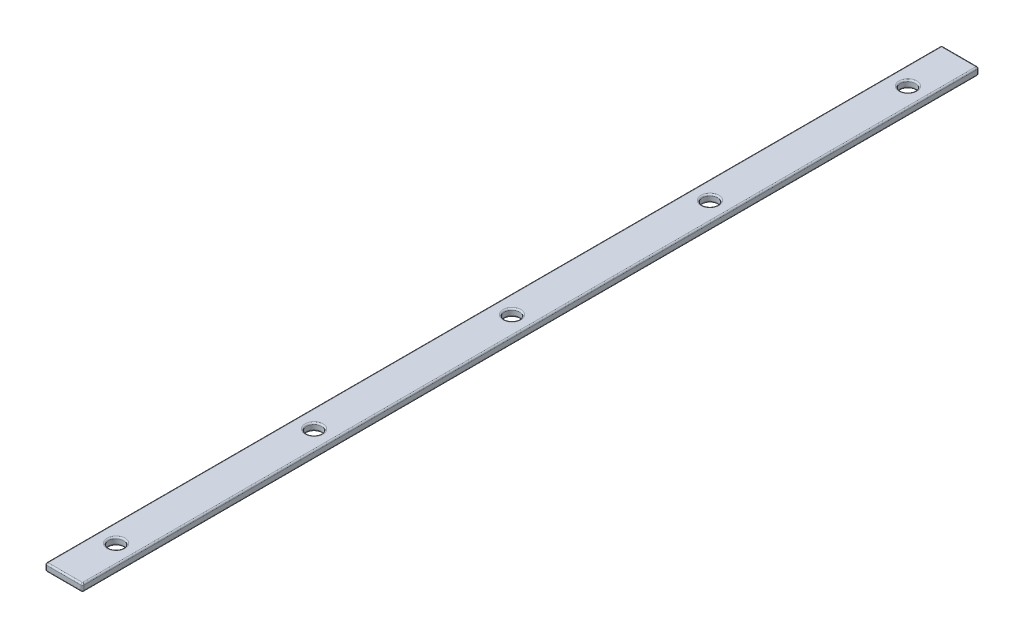
from build123d import *

# Parameters (mm, degrees)
CROQUIS1_W              = 50
CROQUIS1_H              = 1200
CROQUIS1_R              = 10
SALIENTE_EXTRUIR1_DEPTH = 10
REDONDEO1_R             = 2
REDONDEO2_R             = 2


with BuildPart() as part:
    # Croquis1 → Saliente-Extruir1 (new body)
    with BuildSketch(Plane(origin=(0, 0, 0), x_dir=(1, 0, 0), z_dir=(0, 1, 0))):
        Rectangle(CROQUIS1_W, CROQUIS1_H)
        with Locations(Location((0, 0, 0), (0, 0, 270))):
            Circle(CROQUIS1_R, mode=Mode.SUBTRACT)
        with Locations(Location((0, 265, 0), (0, 0, 270))):
            Circle(CROQUIS1_R, mode=Mode.SUBTRACT)
        with Locations(Location((0, 530, 0), (0, 0, 270))):
            Circle(CROQUIS1_R, mode=Mode.SUBTRACT)
        with Locations(Location((0, -530, 0), (0, 0, 270))):
            Circle(CROQUIS1_R, mode=Mode.SUBTRACT)
        with Locations(Location((0, -265, 0), (0, 0, 270))):
            Circle(CROQUIS1_R, mode=Mode.SUBTRACT)
    extrude(amount=SALIENTE_EXTRUIR1_DEPTH)

    # Redondeo1
    redondeo1_edges = [part.edges().sort_by_distance(p)[0] for p in [
        (0, 0, -275),
        (0, 10, -275),
        (-25, 10, 0),
        (0, 0, -10),
        (0, 10, -10),
        (0, 10, 600),
        (0, 0, -540),
        (0, 10, -540),
        (0, 0, 255),
        (0, 10, 255),
        (0, 0, 520),
        (0, 10, 520),
        (25, 10, 0),
        (0, 0, 600),
        (-25, 0, 0),
        (0, 0, -600),
        (25, 0, 0),
        (0, 10, -600),
    ]]
    fillet(redondeo1_edges, radius=REDONDEO1_R)

    # Redondeo2
    # the kernel refuses this fillet: 2 mm, written as the material it takes off along each edge
    with BuildSketch(Plane(origin=(-23, 8, -598), x_dir=(0, 0, -1), z_dir=(-1, 0, 0))) as redondeo2_piece_1_section:
        Polygon((0, 0), (REDONDEO2_R, 0), (REDONDEO2_R, -REDONDEO2_R), (0, -REDONDEO2_R), align=None)
    redondeo2_piece_1 = extrude(amount=REDONDEO2_R, mode=Mode.PRIVATE)
    redondeo2_piece_1 = redondeo2_piece_1 - Plane(origin=(-23, 8, -598), x_dir=(0, -0.7071067811865475, 0.7071067811865475), z_dir=(-1, 0, 0)) * Sphere(REDONDEO2_R, mode=Mode.PRIVATE)
    add(redondeo2_piece_1, mode=Mode.SUBTRACT)
    with BuildSketch(Plane(origin=(23, 8, -598), x_dir=(0, 0, -1), z_dir=(1, 0, 0))) as redondeo2_piece_2_section:
        Polygon((0, 0), (REDONDEO2_R, 0), (REDONDEO2_R, REDONDEO2_R), (0, REDONDEO2_R), align=None)
    redondeo2_piece_2 = extrude(amount=REDONDEO2_R, mode=Mode.PRIVATE)
    redondeo2_piece_2 = redondeo2_piece_2 - Plane(origin=(23, 8, -598), x_dir=(0, -0.7071067811865475, 0.7071067811865475), z_dir=(1, 0, 0)) * Sphere(REDONDEO2_R, mode=Mode.PRIVATE)
    add(redondeo2_piece_2, mode=Mode.SUBTRACT)
    with BuildSketch(Plane(origin=(-23, 8, 598), x_dir=(-1, 0, 0), z_dir=(0, 0, 1))) as redondeo2_piece_3_section:
        Polygon((0, 0), (REDONDEO2_R, 0), (REDONDEO2_R, -REDONDEO2_R), (0, -REDONDEO2_R), align=None)
    redondeo2_piece_3 = extrude(amount=REDONDEO2_R, mode=Mode.PRIVATE)
    redondeo2_piece_3 = redondeo2_piece_3 - Plane(origin=(-23, 8, 598), x_dir=(0.7071067811865475, -0.7071067811865475, 0), z_dir=(0, 0, 1)) * Sphere(REDONDEO2_R, mode=Mode.PRIVATE)
    add(redondeo2_piece_3, mode=Mode.SUBTRACT)
    with BuildSketch(Plane(origin=(23, 8, 598), x_dir=(1, 0, 0), z_dir=(0, 0, 1))) as redondeo2_piece_4_section:
        Polygon((0, 0), (REDONDEO2_R, 0), (REDONDEO2_R, REDONDEO2_R), (0, REDONDEO2_R), align=None)
    redondeo2_piece_4 = extrude(amount=REDONDEO2_R, mode=Mode.PRIVATE)
    redondeo2_piece_4 = redondeo2_piece_4 - Plane(origin=(23, 8, 598), x_dir=(-0.7071067811865475, -0.7071067811865475, 0), z_dir=(0, 0, 1)) * Sphere(REDONDEO2_R, mode=Mode.PRIVATE)
    add(redondeo2_piece_4, mode=Mode.SUBTRACT)
    with BuildSketch(Plane(origin=(23, 2, 598), x_dir=(1, 0, 0), z_dir=(0, 0, 1))) as redondeo2_piece_5_section:
        Polygon((0, 0), (REDONDEO2_R, 0), (REDONDEO2_R, -REDONDEO2_R), (0, -REDONDEO2_R), align=None)
    redondeo2_piece_5 = extrude(amount=REDONDEO2_R, mode=Mode.PRIVATE)
    redondeo2_piece_5 = redondeo2_piece_5 - Plane(origin=(23, 2, 598), x_dir=(-0.7071067811865475, 0.7071067811865475, 0), z_dir=(0, 0, 1)) * Sphere(REDONDEO2_R, mode=Mode.PRIVATE)
    add(redondeo2_piece_5, mode=Mode.SUBTRACT)
    with BuildSketch(Plane(origin=(-23, 2, 598), x_dir=(-1, 0, 0), z_dir=(0, 0, 1))) as redondeo2_piece_6_section:
        Polygon((0, 0), (REDONDEO2_R, 0), (REDONDEO2_R, REDONDEO2_R), (0, REDONDEO2_R), align=None)
    redondeo2_piece_6 = extrude(amount=REDONDEO2_R, mode=Mode.PRIVATE)
    redondeo2_piece_6 = redondeo2_piece_6 - Plane(origin=(-23, 2, 598), x_dir=(0.7071067811865475, 0.7071067811865475, 0), z_dir=(0, 0, 1)) * Sphere(REDONDEO2_R, mode=Mode.PRIVATE)
    add(redondeo2_piece_6, mode=Mode.SUBTRACT)
    with BuildSketch(Plane(origin=(23, 2, -598), x_dir=(0, 0, -1), z_dir=(1, 0, 0))) as redondeo2_piece_7_section:
        Polygon((0, 0), (REDONDEO2_R, 0), (REDONDEO2_R, -REDONDEO2_R), (0, -REDONDEO2_R), align=None)
    redondeo2_piece_7 = extrude(amount=REDONDEO2_R, mode=Mode.PRIVATE)
    redondeo2_piece_7 = redondeo2_piece_7 - Plane(origin=(23, 2, -598), x_dir=(0, 0.7071067811865475, 0.7071067811865475), z_dir=(1, 0, 0)) * Sphere(REDONDEO2_R, mode=Mode.PRIVATE)
    add(redondeo2_piece_7, mode=Mode.SUBTRACT)
    with BuildSketch(Plane(origin=(-23, 2, -598), x_dir=(0, 0, -1), z_dir=(-1, 0, 0))) as redondeo2_piece_8_section:
        Polygon((0, 0), (REDONDEO2_R, 0), (REDONDEO2_R, REDONDEO2_R), (0, REDONDEO2_R), align=None)
    redondeo2_piece_8 = extrude(amount=REDONDEO2_R, mode=Mode.PRIVATE)
    redondeo2_piece_8 = redondeo2_piece_8 - Plane(origin=(-23, 2, -598), x_dir=(0, 0.7071067811865475, 0.7071067811865475), z_dir=(-1, 0, 0)) * Sphere(REDONDEO2_R, mode=Mode.PRIVATE)
    add(redondeo2_piece_8, mode=Mode.SUBTRACT)
    with BuildSketch(Plane(origin=(25, 2, 600), x_dir=(-1, 0, 0), z_dir=(0, 1, 0)), Plane(origin=(25, 2, -600), x_dir=(0, 0, 1), z_dir=(0, 1, 0))) as redondeo2_piece_9:
        with BuildLine():
            CenterArc((REDONDEO2_R, -REDONDEO2_R), REDONDEO2_R, 90, 90)
            Line((0, -REDONDEO2_R), (0, 0))
            Line((0, 0), (REDONDEO2_R, 0))
        make_face()
    extrude(amount=6, mode=Mode.SUBTRACT)
    with BuildSketch(Plane(origin=(-25, 2, 600), x_dir=(1, 0, 0), z_dir=(0, 1, 0)), Plane(origin=(-25, 2, -600), x_dir=(0, 0, 1), z_dir=(0, 1, 0))) as redondeo2_piece_10:
        with BuildLine():
            CenterArc((REDONDEO2_R, REDONDEO2_R), REDONDEO2_R, 180, 90)
            Line((0, REDONDEO2_R), (0, 0))
            Line((0, 0), (REDONDEO2_R, 0))
        make_face()
    extrude(amount=6, mode=Mode.SUBTRACT)


solid = part.part
